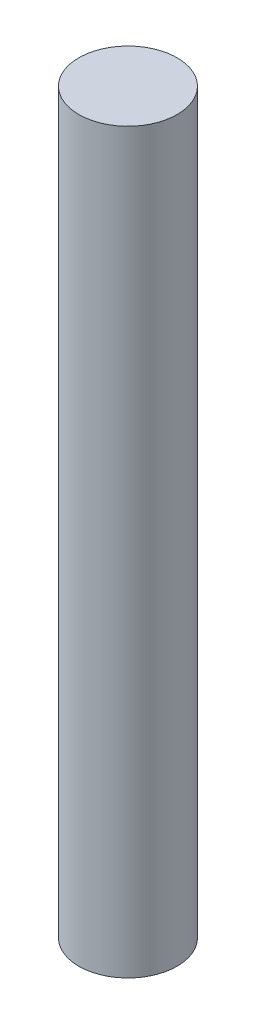
from build123d import *

# Parameters (mm, degrees)
SKETCH2_2_R         = 1
BOSS_EXTRUDE1_DEPTH = 15


with BuildPart() as part:
    # Sketch2<2> → Boss-Extrude1 (new body)
    with BuildSketch(Plane(origin=(0, 0, 0), x_dir=(1, 0, 0), z_dir=(0, 1, 0))):
        with Locations((0, -2.925)):
            Circle(SKETCH2_2_R)
    extrude(amount=BOSS_EXTRUDE1_DEPTH)


solid = part.part
